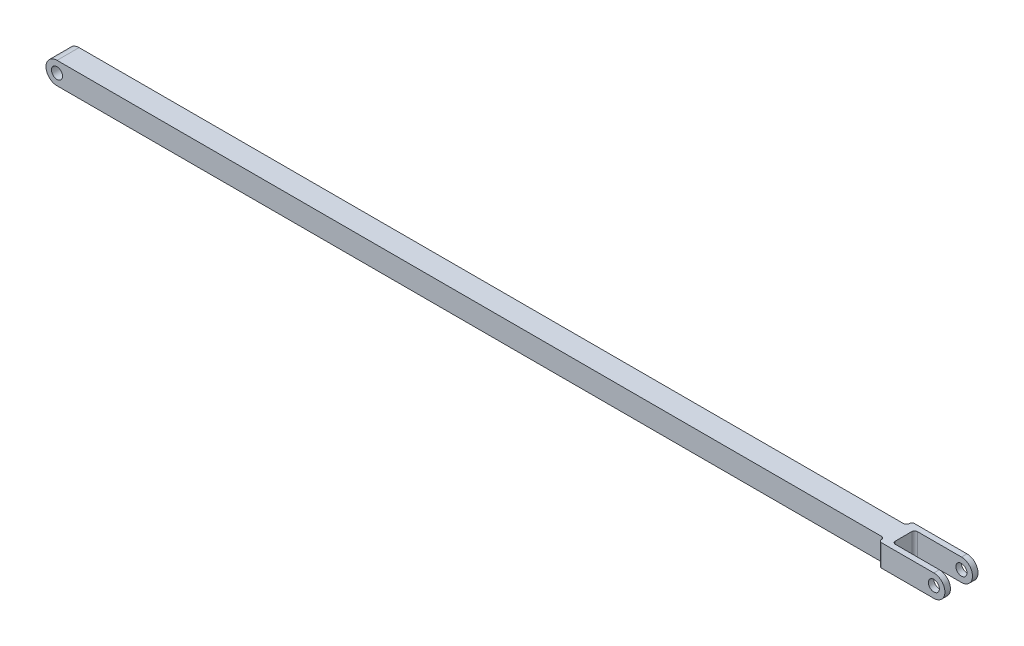
from build123d import *

# Parameters (mm, degrees)
BOSS_EXTRUDE1_DEPTH = 12.7
SKETCH2_R           = 6.35
CUT_EXTRUDE1_DEPTH  = 522.473815258
SKETCH3_W           = 76.2
SKETCH3_H           = 38.1
BOSS_EXTRUDE4_DEPTH = 25.4
SKETCH6_W           = 66.675
SKETCH6_H           = 25.4
CUT_EXTRUDE3_DEPTH  = 522.667089723
SKETCH4_R           = 6.35
CUT_EXTRUDE2_DEPTH  = 523.246483952
FILLET3_R           = 3.175


with BuildPart() as part:
    # Sketch1 → Boss-Extrude1 (new, symmetric)
    with BuildSketch(Plane.XY):
        with BuildLine():
            Line((-508, 12.7), (508, 12.7))
            ThreePointArc((508, 12.7), (520.7, 0), (508, -12.7))
            Line((508, -12.7), (-508, -12.7))
            ThreePointArc((-508, -12.7), (-520.7, 0), (-508, 12.7))
        make_face()
    extrude(amount=BOSS_EXTRUDE1_DEPTH, both=True)

    # Sketch2 → Cut-Extrude1 (cut, through all)
    with BuildSketch(Plane.XY.offset(12.7)):
        with Locations((-508, 0)):
            Circle(SKETCH2_R)
        with Locations((508, 0)):
            Circle(SKETCH2_R)
    extrude(amount=-CUT_EXTRUDE1_DEPTH, mode=Mode.SUBTRACT)

    # Sketch3 → Boss-Extrude4 (add, through all)
    with BuildSketch(Plane(origin=(0, 12.7, 0), x_dir=(1, 0, 0), z_dir=(0, 1, 0))):
        with Locations((482.6, 0)):
            Rectangle(SKETCH3_W, SKETCH3_H)
    extrude(amount=-BOSS_EXTRUDE4_DEPTH)

    # Sketch6 → Cut-Extrude3 (cut, through all)
    with BuildSketch(Plane(origin=(0, 12.7, 0), x_dir=(1, 0, 0), z_dir=(0, 1, 0))):
        with Locations((487.3625, 0)):
            Rectangle(SKETCH6_W, SKETCH6_H)
    extrude(amount=-CUT_EXTRUDE3_DEPTH, mode=Mode.SUBTRACT)

    # Sketch4 → Cut-Extrude2 (cut, through all)
    with BuildSketch(Plane.XY.offset(19.05)):
        with BuildLine():
            Line((520.7, 0), (520.7, 12.7))
            Line((520.7, 12.7), (508, 12.7))
            ThreePointArc((508, 12.7), (516.980256121, 8.980256121), (520.7, 0))
        make_face()
        with BuildLine():
            Line((520.7, -12.7), (520.7, 0))
            ThreePointArc((520.7, 0), (516.980256121, -8.980256121), (508, -12.7))
            Line((508, -12.7), (520.7, -12.7))
        make_face()
        with Locations((508, 0)):
            Circle(SKETCH4_R)
    extrude(amount=-CUT_EXTRUDE2_DEPTH, mode=Mode.SUBTRACT)

    # Fillet3
    fillet3_edges = [part.edges().sort_by_distance(p)[0] for p in [
        (454.025, 0, 12.7),
        (444.5, 0, -19.05),
        (444.5, 0, -12.7),
        (444.5, 0, 12.7),
        (454.025, 0, -12.7),
        (444.5, 0, 19.05),
    ]]
    fillet(fillet3_edges, radius=FILLET3_R - 0.0001)  # a hair under: the kernel refuses the full size


solid = part.part
